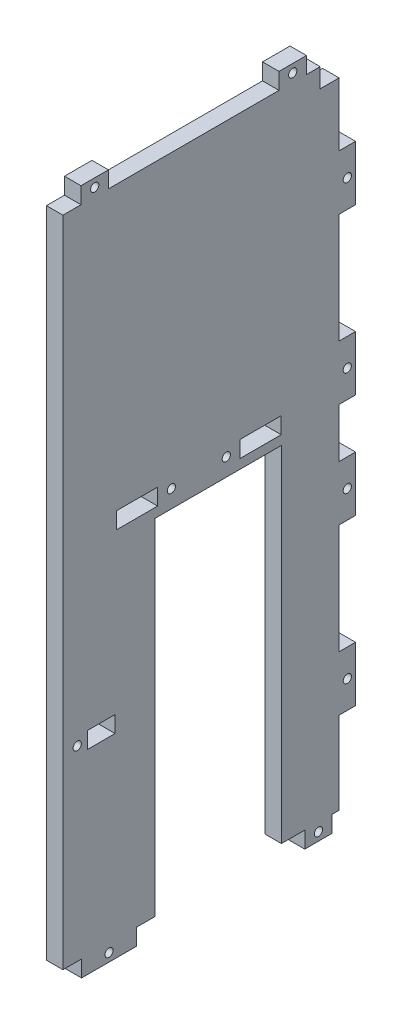
from build123d import *

# Parameters (mm, degrees)
ESQUISSE1_W             = 100.58
ESQUISSE1_H             = 238
ESQUISSE1_W_2           = 10
ESQUISSE1_H_2           = 6
ESQUISSE1_W_3           = 15
BOSS_EXTRU_1_DEPTH      = 6
ESQUISSE3_W             = 20
ESQUISSE3_H             = 6
ESQUISSE3_W_2           = 10
ESQUISSE3_W_3           = 6
ESQUISSE3_H_2           = 20
BOSS_EXTRU_5_DEPTH      = 6
ESQUISSE6_W             = 46
ESQUISSE6_H             = 125.59
ENL_V_MAT_EXTRU_2_DEPTH = 6
ESQUISSE7_W             = 6.88
ESQUISSE7_H             = 7
ENL_V_MAT_EXTRU_3_DEPTH = 6
ESQUISSE8_R             = 1.5
ENL_V_MAT_EXTRU_4_DEPTH = 6


with BuildPart() as part:
    # Esquisse1 → Boss.-Extru.1 (new body)
    with BuildSketch(Plane(origin=(0, 0, 0), x_dir=(0, 0, -1), z_dir=(1, 0, 0))):
        Rectangle(ESQUISSE1_W, ESQUISSE1_H)
        with Locations((-36.29, -51)):
            Rectangle(ESQUISSE1_W_2, ESQUISSE1_H_2, mode=Mode.SUBTRACT)
        with Locations((-23.295, 13)):
            Rectangle(ESQUISSE1_W_3, ESQUISSE1_H_2, mode=Mode.SUBTRACT)
        with Locations((21.705, 13)):
            Rectangle(ESQUISSE1_W_3, ESQUISSE1_H_2, mode=Mode.SUBTRACT)
    extrude(amount=BOSS_EXTRU_1_DEPTH)

    # Esquisse3 → Boss.-Extru.5 (add)
    with BuildSketch(Plane(origin=(6, 0, 0), x_dir=(0, 0, -1), z_dir=(1, 0, 0))):
        with Locations((-33.5, -122)):
            Rectangle(ESQUISSE3_W, ESQUISSE3_H)
        with Locations((42.79, -122)):
            Rectangle(ESQUISSE3_W_2, ESQUISSE3_H)
        with Locations((53.29, 19)):
            Rectangle(ESQUISSE3_W_3, ESQUISSE3_H_2)
        with Locations((53.29, 79)):
            Rectangle(ESQUISSE3_W_3, ESQUISSE3_H_2)
        with Locations((53.29, -79)):
            Rectangle(ESQUISSE3_W_3, ESQUISSE3_H_2)
        with Locations((53.29, -19)):
            Rectangle(ESQUISSE3_W_3, ESQUISSE3_H_2)
        with Locations((33.41, 122)):
            Rectangle(ESQUISSE3_W_2, ESQUISSE3_H)
        with Locations((-38.71, 122)):
            Rectangle(ESQUISSE3_W_2, ESQUISSE3_H)
    extrude(amount=-BOSS_EXTRU_5_DEPTH)

    # Esquisse6 → Enlèv. mat.-Extru.2 (cut)
    with BuildSketch(Plane(origin=(6, 0, 0), x_dir=(0, 0, -1), z_dir=(1, 0, 0))):
        with Locations((6.29, -56.205)):
            Rectangle(ESQUISSE6_W, ESQUISSE6_H)
    extrude(amount=-ENL_V_MAT_EXTRU_2_DEPTH, mode=Mode.SUBTRACT)

    # Esquisse7 → Enlèv. mat.-Extru.3 (cut)
    with BuildSketch(Plane.ZY):
        with Locations((-46.85, 115.5)):
            Rectangle(ESQUISSE7_W, ESQUISSE7_H)
    extrude(amount=-ENL_V_MAT_EXTRU_3_DEPTH, mode=Mode.SUBTRACT)

    # Esquisse8 → Enlèv. mat.-Extru.4 (cut)
    with BuildSketch(Plane.ZY):
        with Locations((-9.205, 13)):
            Circle(ESQUISSE8_R)
        with Locations((10.795, 13)):
            Circle(ESQUISSE8_R)
        with Locations((45.08, -51)):
            Circle(ESQUISSE8_R)
        with Locations((38.71, 122)):
            Circle(ESQUISSE8_R)
        with Locations((-33.41, 122)):
            Circle(ESQUISSE8_R)
        with Locations((33.5, -122)):
            Circle(ESQUISSE8_R)
        with Locations((-53.29, 79)):
            Circle(ESQUISSE8_R)
        with Locations((-42.79, -122)):
            Circle(ESQUISSE8_R)
        with Locations((-53.29, 19)):
            Circle(ESQUISSE8_R)
        with Locations((-53.29, -79)):
            Circle(ESQUISSE8_R)
        with Locations((-53.29, -19)):
            Circle(ESQUISSE8_R)
    extrude(amount=-ENL_V_MAT_EXTRU_4_DEPTH, mode=Mode.SUBTRACT)


solid = part.part
